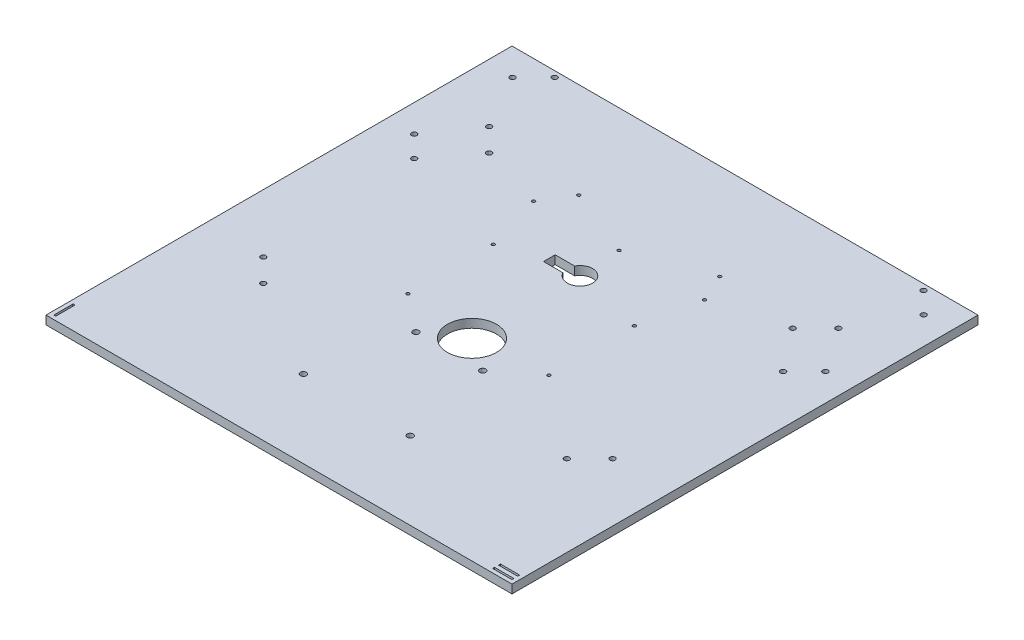
from build123d import *

# Parameters (mm, degrees)
SKETCH2_W           = 304.8
SKETCH2_H           = 304.8
BOSS_EXTRUDE1_DEPTH = 5.588
SKETCH4_W           = 1.27
SKETCH4_H           = 12.7
SKETCH4_W_2         = 12.7
SKETCH4_H_2         = 1.27
CUT_EXTRUDE1_DEPTH  = 432.088512656
SKETCH5_W           = 228.854
SKETCH5_H           = 12.954
CUT_EXTRUDE2_DEPTH  = 0.254
SKETCH6_R           = 16.002
SKETCH6_R_2         = 1.7
SKETCH6_R_3         = 1.96
CUT_EXTRUDE3_DEPTH  = 432.088512656
CUT_EXTRUDE4_DEPTH  = 432.088512656
SKETCH8_R           = 1.016
CUT_EXTRUDE5_DEPTH  = 432.088512656
SKETCH9_R           = 1.016
CUT_EXTRUDE6_DEPTH  = 432.088512656
BOSS_EXTRUDE3_REACH = 433.089
SKETCH10_W          = 236.011664121
SKETCH10_H          = 22.945578457


with BuildPart() as part:
    # Sketch2 → Boss-Extrude1 (new body)
    with BuildSketch(Plane(origin=(0, 0, 0), x_dir=(1, 0, 0), z_dir=(0, 1, 0))):
        with Locations((152.4, 152.4)):
            Rectangle(SKETCH2_W, SKETCH2_H)
    extrude(amount=BOSS_EXTRUDE1_DEPTH)

    # Sketch4 → Cut-Extrude1 (cut, through all)
    with BuildSketch(Plane(origin=(0, 5.588, 0), x_dir=(1, 0, 0), z_dir=(0, 1, 0))):
        with Locations((3.175, 8.89)):
            Rectangle(SKETCH4_W, SKETCH4_H)
        with Locations((295.91, 3.175)):
            Rectangle(SKETCH4_W_2, SKETCH4_H_2)
        with Locations((295.91, 6.985)):
            Rectangle(SKETCH4_W_2, SKETCH4_H_2)
    extrude(amount=-CUT_EXTRUDE1_DEPTH, mode=Mode.SUBTRACT)

    # Sketch5 → Cut-Extrude2 (cut)
    with BuildSketch(Plane(origin=(0, 5.588, 0), x_dir=(1, 0, 0), z_dir=(0, 1, 0))):
        with Locations((148.97354, 274.58924)):
            Rectangle(SKETCH5_W, SKETCH5_H)
    extrude(amount=-CUT_EXTRUDE2_DEPTH, mode=Mode.SUBTRACT)

    # Sketch6 → Cut-Extrude3 (cut, through all)
    with BuildSketch(Plane(origin=(0, 5.588, 0), x_dir=(1, 0, 0), z_dir=(0, 1, 0))):
        with Locations((152.4799846, 126.1262654)):
            Circle(SKETCH6_R)
        with Locations((31.75, 300.959132824)):
            Circle(SKETCH6_R_2)
        with Locations((17.93875, 287.147882824)):
            Circle(SKETCH6_R_2)
        with Locations((273.05, 300.959132824)):
            Circle(SKETCH6_R_2)
        with Locations((286.86125, 287.147882824)):
            Circle(SKETCH6_R_2)
        with Locations((286.86125, 222.906202824)):
            Circle(SKETCH6_R_2)
        with Locations((273.05, 209.094952824)):
            Circle(SKETCH6_R_2)
        with Locations((31.75, 209.094952824)):
            Circle(SKETCH6_R_2)
        with Locations((17.93875, 222.906202824)):
            Circle(SKETCH6_R_2)
        with Locations((38.1787654, 103.9330154)):
            Circle(SKETCH6_R_2)
        with Locations((53.1330154, 88.9787654)):
            Circle(SKETCH6_R_2)
        with Locations((251.6669846, 88.9787654)):
            Circle(SKETCH6_R_2)
        with Locations((266.6212346, 103.9330154)):
            Circle(SKETCH6_R_2)
        with Locations((266.6212346, 251.6669846)):
            Circle(SKETCH6_R_2)
        with Locations((251.6669846, 236.7127346)):
            Circle(SKETCH6_R_2)
        with Locations((53.1330154, 236.7127346)):
            Circle(SKETCH6_R_2)
        with Locations((38.1787654, 251.6669846)):
            Circle(SKETCH6_R_2)
        with Locations((130.6518596, 111.328047494)):
            Circle(SKETCH6_R_3)
        with Locations((174.3081096, 111.328047494)):
            Circle(SKETCH6_R_3)
        with Locations((187.4049846, 50.821596477)):
            Circle(SKETCH6_R_3)
        with Locations((117.5549846, 50.821596477)):
            Circle(SKETCH6_R_3)
    extrude(amount=-CUT_EXTRUDE3_DEPTH, mode=Mode.SUBTRACT)

    # Sketch7 → Cut-Extrude4 (cut, through all)
    with BuildSketch(Plane(origin=(0, 5.588, 0), x_dir=(1, 0, 0), z_dir=(0, 1, 0))):
        with BuildLine():
            Line((145.076822752, 200.66), (132.376822752, 200.66))
            Line((132.376822752, 200.66), (132.376822752, 193.04))
            Line((132.376822752, 193.04), (145.076822752, 193.04))
            ThreePointArc((145.076822752, 193.04), (160.655, 196.85), (145.076822752, 200.66))
        make_face()
    extrude(amount=-CUT_EXTRUDE4_DEPTH, mode=Mode.SUBTRACT)

    # Sketch8 → Cut-Extrude5 (cut, through all)
    with BuildSketch(Plane(origin=(0, 5.588, 0), x_dir=(1, 0, 0), z_dir=(0, 1, 0))):
        with Locations((206.6999846, 223.9950154)):
            Circle(SKETCH8_R)
        with Locations((150.8199846, 223.9950154)):
            Circle(SKETCH8_R)
        with Locations((94.9399846, 223.9950154)):
            Circle(SKETCH8_R)
    extrude(amount=-CUT_EXTRUDE5_DEPTH, mode=Mode.SUBTRACT)

    # Sketch9 → Cut-Extrude6 (cut, through all)
    with BuildSketch(Plane(origin=(0, 5.588, 0), x_dir=(1, 0, 0), z_dir=(0, 1, 0))):
        with Locations((106.3, 242.18)):
            Circle(SKETCH9_R)
        with Locations((106.3, 186.3)):
            Circle(SKETCH9_R)
        with Locations((106.3, 130.42)):
            Circle(SKETCH9_R)
        with Locations((198.5, 130.42)):
            Circle(SKETCH9_R)
        with Locations((198.5, 186.3)):
            Circle(SKETCH9_R)
        with Locations((198.5, 242.18)):
            Circle(SKETCH9_R)
    extrude(amount=-CUT_EXTRUDE6_DEPTH, mode=Mode.SUBTRACT)

    # Sketch10 → Boss-Extrude3 (add, up to next)
    with BuildSketch(Plane(origin=(0, 5.588, 0), x_dir=(1, 0, 0), z_dir=(0, 1, 0)), mode=Mode.PRIVATE) as boss_extrude3_sk1:
        with Locations((148.069627159, 275.695978824)):
            Rectangle(SKETCH10_W, SKETCH10_H)
    boss_extrude3_tool1 = extrude(boss_extrude3_sk1.sketch, amount=-BOSS_EXTRUDE3_REACH, mode=Mode.PRIVATE) - part.part
    add(boss_extrude3_tool1.solids().sort_by_distance((148.069627, 5.588, -275.695979))[0])


solid = part.part
